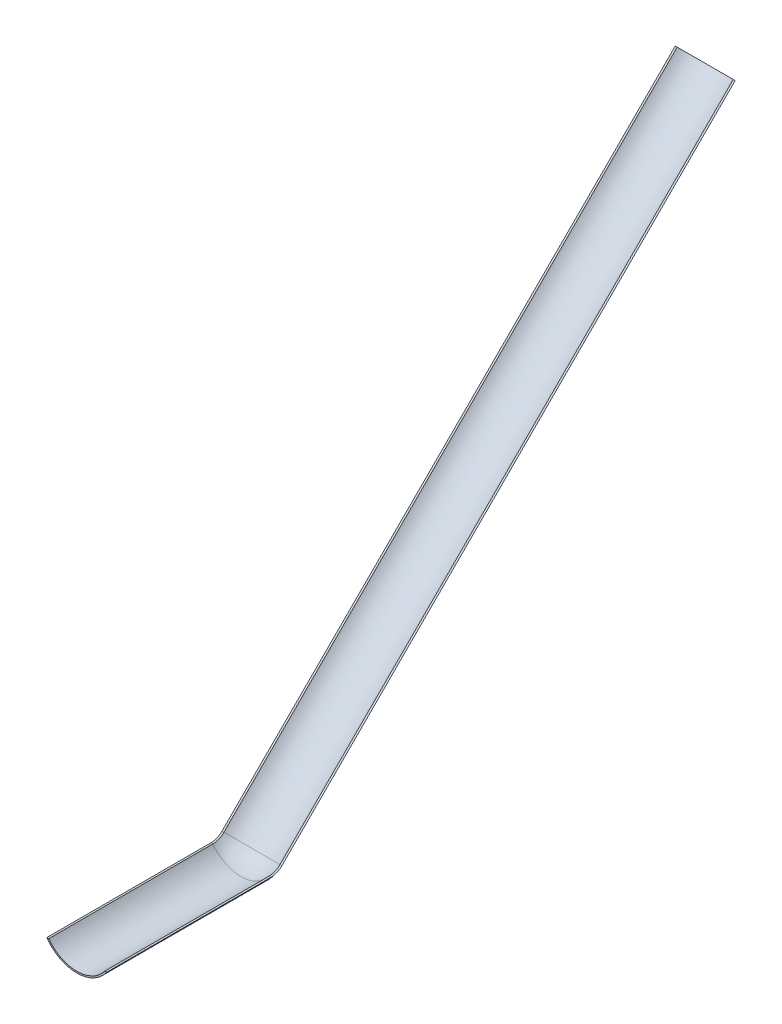
from build123d import *


with BuildPart() as part:
    # Sweep1: sweep along a path in Sketch1
    with BuildLine(Plane(origin=(0, 0, 0), x_dir=(0, 0, -1), z_dir=(1, 0, 0))) as sweep1_path:
        Line((0, 0), (52, 0))
        ThreePointArc((52, 0), (55.826834324, 0.761204675), (59.071067812, 2.928932188))
        Line((59.071067812, 2.928932188), (202.755165749, 146.613030125))
    # Sketch2 → Sweep1 (sweep)
    with BuildSketch(Plane.XY):
        with BuildLine():
            Line((-9.5, 5), (-8.886787946, 5))
            ThreePointArc((-8.886787946, 5), (0, 0.5), (8.886787946, 5))
            Line((8.886787946, 5), (9.5, 5))
            ThreePointArc((9.5, 5), (0, 0), (-9.5, 5))
        make_face()
    sweep(path=sweep1_path.line)


solid = part.part
